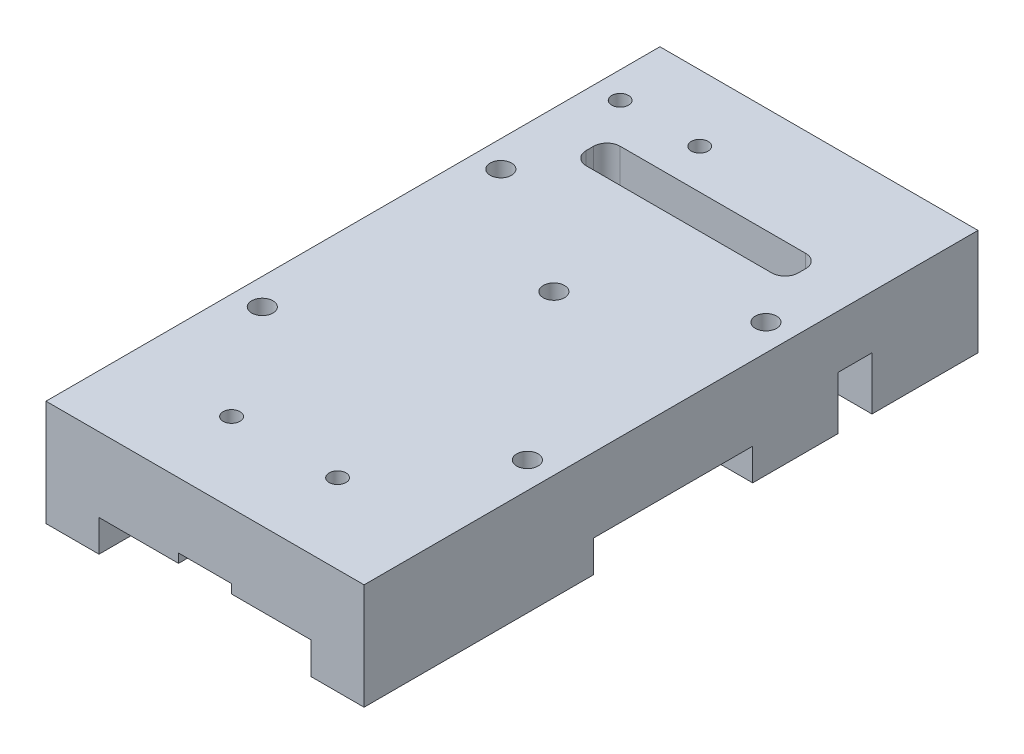
from build123d import *

# Parameters (mm, degrees)
BOSS_EXTRUDE1_DEPTH         = 12.7
BOSS_EXTRUDE1_DEPTH_BACK    = 12.7
SKETCH1_W                   = 76.2
SKETCH1_H                   = 147.066
SKETCH2_R                   = 4.7625
CUT_EXTRUDE1_DEPTH          = 25.4
CUT_EXTRUDE2_DEPTH          = 7.62
CUT_EXTRUDE4_DEPTH          = 84.785452729
CUT_EXTRUDE4_DEPTH_BACK     = 84.785452729
F_1_4_20_TAPPED_HOLE1_D     = 5.1054
F_1_4_20_TAPPED_HOLE1_DEPTH = 19.05
F_1_4_20_TAPPED_HOLE1_TIP   = 1.533816902
SKETCH9_R                   = 2.5527
SKETCH9_R_2                 = 2.0193
CUT_EXTRUDE5_DEPTH          = 87.62489301
CUT_EXTRUDE6_REACH          = 103.385
CUT_EXTRUDE7_DEPTH          = 2.159
SKETCH12_R                  = 2.0193
CUT_EXTRUDE8_DEPTH          = 85.704430162
SKETCH13_W                  = 15.875
SKETCH13_H                  = 8.128
CUT_EXTRUDE9_DEPTH          = 12.7


with BuildPart() as part:
    # Sketch1 → Boss-Extrude1 (new, two sides: drawn at the far end of the back side and taken through both)
    with BuildSketch(Plane(origin=(0, 0, 0), x_dir=(1, 0, 0), z_dir=(0, 1, 0)).offset(-BOSS_EXTRUDE1_DEPTH_BACK)):
        Rectangle(SKETCH1_W, SKETCH1_H)
    extrude(amount=BOSS_EXTRUDE1_DEPTH + BOSS_EXTRUDE1_DEPTH_BACK)

    # Sketch2 → Cut-Extrude1 (cut)
    with BuildSketch(Plane(origin=(0, 0, -73.533), x_dir=(-1, 0, 0), z_dir=(0, 0, -1))):
        with Locations((0, -12.7)):
            Circle(SKETCH2_R)
    extrude(amount=-CUT_EXTRUDE1_DEPTH, mode=Mode.SUBTRACT)

    # Sketch3 → Cut-Extrude2 (cut)
    with BuildSketch(Plane(origin=(0, -12.7, 0), x_dir=(-1, 0, 0), z_dir=(0, -1, 0))):
        with BuildLine():
            Line((-19.05, -83.058), (19.05, -83.058))
            ThreePointArc((19.05, -83.058), (23.540128061, -81.198128061), (25.4, -76.708))
            Line((25.4, -76.708), (25.4, -18.542))
            Line((25.4, -18.542), (44.45, -18.542))
            Line((44.45, -18.542), (44.45, 19.558))
            Line((44.45, 19.558), (-44.45, 19.558))
            Line((-44.45, 19.558), (-44.45, -18.542))
            Line((-44.45, -18.542), (-25.4, -18.542))
            Line((-25.4, -18.542), (-25.4, -76.708))
            ThreePointArc((-25.4, -76.708), (-23.540128061, -81.198128061), (-19.05, -83.058))
        make_face()
    extrude(amount=-CUT_EXTRUDE2_DEPTH, mode=Mode.SUBTRACT)

    # Sketch5 → Cut-Extrude4 (cut, two sides: drawn at the far end of the back side and taken through both)
    with BuildSketch(Plane(origin=(0, 0, 0), x_dir=(1, 0, 0), z_dir=(0, 1, 0)).offset(-CUT_EXTRUDE4_DEPTH_BACK)):
        with BuildLine():
            Line((22.225, 48.133), (-22.225, 48.133))
            ThreePointArc((-22.225, 48.133), (-24.47006403, 47.20306403), (-25.4, 44.958))
            Line((-25.4, 44.958), (-25.4, 43.18))
            ThreePointArc((-25.4, 43.18), (-24.47006403, 40.93493597), (-22.225, 40.005))
            Line((-22.225, 40.005), (22.225, 40.005))
            ThreePointArc((22.225, 40.005), (24.47006403, 40.93493597), (25.4, 43.18))
            Line((25.4, 43.18), (25.4, 44.958))
            ThreePointArc((25.4, 44.958), (24.47006403, 47.20306403), (22.225, 48.133))
        make_face()
    extrude(amount=CUT_EXTRUDE4_DEPTH + CUT_EXTRUDE4_DEPTH_BACK, mode=Mode.SUBTRACT)

    # 1/4-20 Tapped Hole1
    with Locations(Plane(origin=(-11.034450397, 12.7, 14.547513529), x_dir=(-1, 0, 0), z_dir=(0, 1, 0))):
        with Locations((-11.034450397, -24.580513529)):
            Hole(F_1_4_20_TAPPED_HOLE1_D / 2, depth=F_1_4_20_TAPPED_HOLE1_DEPTH)
            with Locations((0, 0, -(F_1_4_20_TAPPED_HOLE1_DEPTH + F_1_4_20_TAPPED_HOLE1_TIP / 2))):  # 118° drill point
                Cone(0, F_1_4_20_TAPPED_HOLE1_D / 2, F_1_4_20_TAPPED_HOLE1_TIP, mode=Mode.SUBTRACT)

    # Sketch9 → Cut-Extrude5 (cut, through all)
    with BuildSketch(Plane(origin=(0, -12.7, 0), x_dir=(-1, 0, 0), z_dir=(0, -1, 0))):
        with Locations((31.75, 29.083)):
            Circle(SKETCH9_R)
        with Locations((31.75, -28.067)):
            Circle(SKETCH9_R)
        with Locations((-31.75, -28.067)):
            Circle(SKETCH9_R)
        with Locations((-31.75, 29.083)):
            Circle(SKETCH9_R)
        with Locations((31.75, 57.658)):
            Circle(SKETCH9_R_2)
        with Locations((12.7, 57.658)):
            Circle(SKETCH9_R_2)
    extrude(amount=-CUT_EXTRUDE5_DEPTH, mode=Mode.SUBTRACT)

    # Sketch10 → Cut-Extrude6 (cut, up to next)
    with BuildSketch(Plane.XY.offset(-19.558), mode=Mode.PRIVATE) as cut_extrude6_sk1:
        with BuildLine():
            Line((-10.939706577, -10.414), (-12.209706577, -10.414))
            Line((-12.209706577, -10.414), (-12.209706577, -14.986))
            Line((-12.209706577, -14.986), (-10.939706577, -14.986))
            ThreePointArc((-10.939706577, -14.986), (0, -23.876), (10.939706577, -14.986))
            Line((10.939706577, -14.986), (12.209706577, -14.986))
            Line((12.209706577, -14.986), (12.209706577, -10.414))
            Line((12.209706577, -10.414), (10.939706577, -10.414))
            ThreePointArc((10.939706577, -10.414), (0, -1.524), (-10.939706577, -10.414))
        make_face()
    cut_extrude6_tool1 = extrude(cut_extrude6_sk1.sketch, amount=-CUT_EXTRUDE6_REACH, mode=Mode.PRIVATE) & part.part
    add(cut_extrude6_tool1.solids().sort_by_distance((0, -12.7, -19.558))[0], mode=Mode.SUBTRACT)

    # Sketch11 → Cut-Extrude7 (cut)
    with BuildSketch(Plane(origin=(0, -5.08, 0), x_dir=(-1, 0, 0), z_dir=(0, -1, 0))):
        with BuildLine():
            Line((0.00254, -32.893), (-0.00254, -32.893))
            ThreePointArc((-0.00254, -32.893), (-4.490872009, -34.752127991), (-6.35, -39.24046))
            Line((-6.35, -39.24046), (-6.35, -73.533))
            Line((-6.35, -73.533), (6.35, -73.533))
            Line((6.35, -73.533), (6.35, -39.24046))
            ThreePointArc((6.35, -39.24046), (4.490872009, -34.752127991), (0.00254, -32.893))
        make_face()
    extrude(amount=-CUT_EXTRUDE7_DEPTH, mode=Mode.SUBTRACT)

    # Sketch12 → Cut-Extrude8 (cut, through all)
    with BuildSketch(Plane.XZ.offset(5.08)):
        with Locations((12.7, 54.483)):
            Circle(SKETCH12_R)
        with Locations((-12.7, 54.483)):
            Circle(SKETCH12_R)
    extrude(amount=-CUT_EXTRUDE8_DEPTH, mode=Mode.SUBTRACT)

    # Sketch13 → Cut-Extrude9 (cut)
    with BuildSketch(Plane.XZ.offset(12.7)):
        with Locations((30.1625, -44.069)):
            Rectangle(SKETCH13_W, SKETCH13_H)
    extrude(amount=-CUT_EXTRUDE9_DEPTH, mode=Mode.SUBTRACT)


solid = part.part
